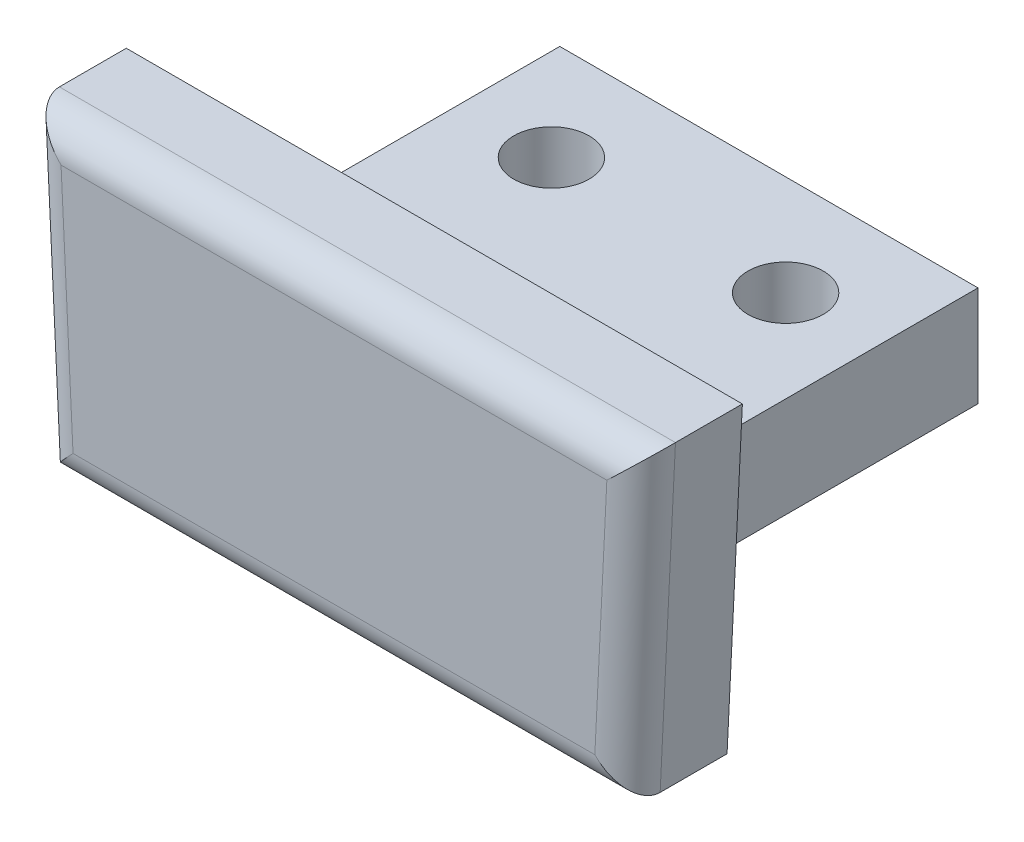
from build123d import *

# Parameters (mm, degrees)
SKETCH1_W           = 25
SKETCH1_H           = 26
BOSS_EXTRUDE1_DEPTH = 6
SKETCH2_R           = 2.25
CUT_EXTRUDE1_DEPTH  = 6
SKETCH4_W           = 25
SKETCH4_H           = 6
BOSS_EXTRUDE2_DEPTH = 5.62
BOSS_EXTRUDE3_DEPTH = 6
FILLET1_R           = 2


with BuildPart() as part:
    # Sketch1 → Boss-Extrude1 (new body)
    with BuildSketch(Plane(origin=(0, 0, 0), x_dir=(1, 0, 0), z_dir=(0, 1, 0))):
        with Locations((12.5, 13)):
            Rectangle(SKETCH1_W, SKETCH1_H)
    extrude(amount=BOSS_EXTRUDE1_DEPTH)

    # Sketch2 → Cut-Extrude1 (cut)
    with BuildSketch(Plane.XZ):
        with Locations((5.5, -20)):
            Circle(SKETCH2_R)
        with Locations((19.5, -20)):
            Circle(SKETCH2_R)
    extrude(amount=-CUT_EXTRUDE1_DEPTH, mode=Mode.SUBTRACT)

    # Sketch4 → Boss-Extrude2 (add)
    with BuildSketch(Plane(origin=(0, 0, 0), x_dir=(-1, 0, 0), z_dir=(0, -1, 0))):
        with Locations((-12.5, 3)):
            Rectangle(SKETCH4_W, SKETCH4_H)
    extrude(amount=BOSS_EXTRUDE2_DEPTH)

    # Sketch5 → Boss-Extrude3 (add)
    with BuildSketch(Plane.XY):
        Polygon((-5, -5.62), (30, -5.62), (30.915, 12.95), (-5.91332664, 12.95), align=None)
    extrude(amount=-BOSS_EXTRUDE3_DEPTH)

    # Fillet1
    fillet1_edges = [part.edges().sort_by_distance(p)[0] for p in [
        (12.50083668, 12.95, 0),
        (30.4575, 3.665, 0),
        (12.5, -5.62, 0),
        (-5.45666332, 3.665, 0),
    ]]
    fillet(fillet1_edges, radius=FILLET1_R)


solid = part.part
